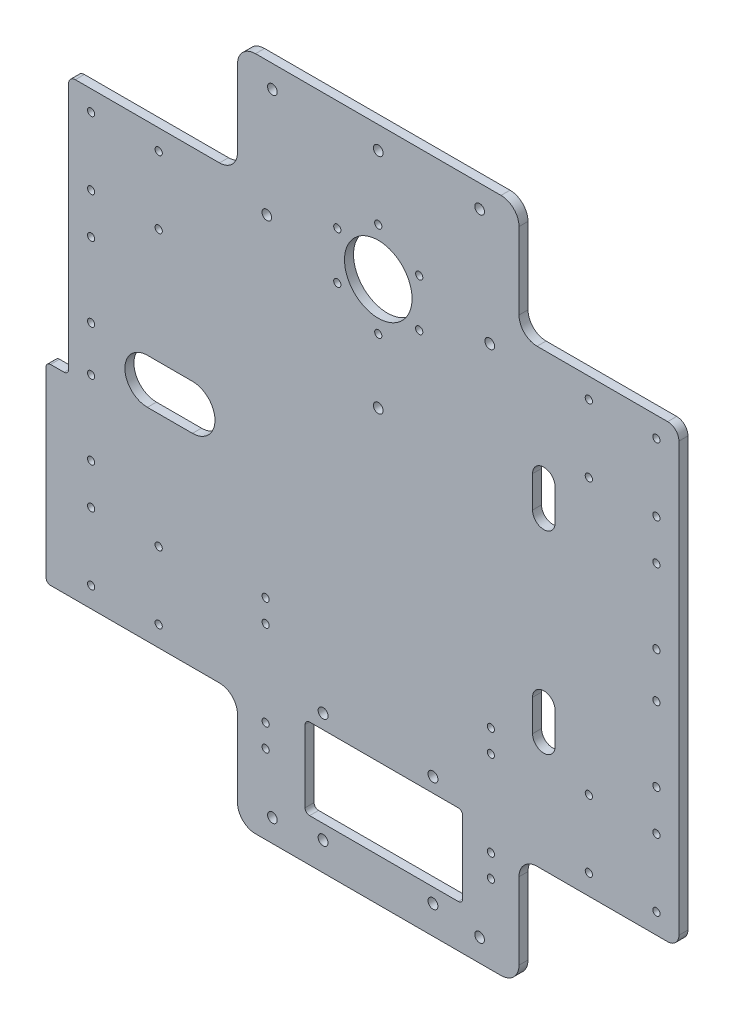
from build123d import *

# Parameters (mm, degrees)
SKETCH_281X300_25_R   = 1.6
SKETCH_281X300_25_R_2 = 15
SKETCH_281X300_25_R_3 = 2.15
SKETCH_281X300_25_R_4 = 2.2
F_4MM_DEPTH           = 4


with BuildPart() as part:
    # 底板轮廓_281x300_安装孔外移25 → 凸台拉伸_4mm (new body)
    with BuildSketch(Plane.XY):
        with BuildLine():
            Line((-55.5, 108), (-55.5, 142))
            ThreePointArc((-55.5, 142), (-53.156854249, 147.656854249), (-47.5, 150))
            Line((-47.5, 150), (61.5, 150))
            ThreePointArc((61.5, 150), (67.156854249, 147.656854249), (69.5, 142))
            Line((69.5, 142), (69.5, 108))
            ThreePointArc((69.5, 108), (71.843145751, 102.343145751), (77.5, 100))
            Line((77.5, 100), (135.5, 100))
            ThreePointArc((135.5, 100), (139.035533906, 98.535533906), (140.5, 95))
            Line((140.5, 95), (140.5, -95))
            ThreePointArc((140.5, -95), (139.035533906, -98.535533906), (135.5, -100))
            Line((135.5, -100), (77.5, -100))
            ThreePointArc((77.5, -100), (71.843145751, -102.343145751), (69.5, -108))
            Line((69.5, -108), (69.5, -142))
            ThreePointArc((69.5, -142), (67.156854249, -147.656854249), (61.5, -150))
            Line((61.5, -150), (-47.5, -150))
            ThreePointArc((-47.5, -150), (-53.156854249, -147.656854249), (-55.5, -142))
            Line((-55.5, -142), (-55.5, -108))
            ThreePointArc((-55.5, -108), (-57.843145751, -102.343145751), (-63.5, -100))
            Line((-63.5, -100), (-138.5, -100))
            ThreePointArc((-138.5, -100), (-139.914213562, -99.414213562), (-140.5, -98))
            Line((-140.5, -98), (-140.5, -17))
            ThreePointArc((-140.5, -17), (-139.914213562, -15.585786438), (-138.5, -15))
            Line((-138.5, -15), (-132.5, -15))
            ThreePointArc((-132.5, -15), (-131.085786438, -14.414213562), (-130.5, -13))
            Line((-130.5, -13), (-130.5, 97))
            ThreePointArc((-130.5, 97), (-129.621320344, 99.121320344), (-127.5, 100))
            Line((-127.5, 100), (-63.5, 100))
            ThreePointArc((-63.5, 100), (-57.843145751, 102.343145751), (-55.5, 108))
        make_face()
        with Locations((100.5, -61)):
            Circle(SKETCH_281X300_25_R, mode=Mode.SUBTRACT)
        with Locations((130.5, -61)):
            Circle(SKETCH_281X300_25_R, mode=Mode.SUBTRACT)
        with Locations((100.5, 61)):
            Circle(SKETCH_281X300_25_R, mode=Mode.SUBTRACT)
        with Locations((7, 90.5)):
            Circle(SKETCH_281X300_25_R_2, mode=Mode.SUBTRACT)
        with Locations((7, 140)):
            Circle(SKETCH_281X300_25_R_3, mode=Mode.SUBTRACT)
        with Locations((-42.5, 90.5)):
            Circle(SKETCH_281X300_25_R_3, mode=Mode.SUBTRACT)
        with Locations((56.5, 90.5)):
            Circle(SKETCH_281X300_25_R_3, mode=Mode.SUBTRACT)
        with Locations((-40, 140)):
            Circle(SKETCH_281X300_25_R_3, mode=Mode.SUBTRACT)
        with Locations((130.5, 61)):
            Circle(SKETCH_281X300_25_R, mode=Mode.SUBTRACT)
        with Locations((7, 41)):
            Circle(SKETCH_281X300_25_R_3, mode=Mode.SUBTRACT)
        with Locations((31.290367902, -137.395183951)):
            Circle(SKETCH_281X300_25_R_4, mode=Mode.SUBTRACT)
        with Locations((-17.5, -137.395183951)):
            Circle(SKETCH_281X300_25_R_4, mode=Mode.SUBTRACT)
        with Locations((-17.5, -88.604816049)):
            Circle(SKETCH_281X300_25_R_4, mode=Mode.SUBTRACT)
        with Locations((31.290367902, -88.604816049)):
            Circle(SKETCH_281X300_25_R_4, mode=Mode.SUBTRACT)
        with Locations((7, 111.5)):
            Circle(SKETCH_281X300_25_R, mode=Mode.SUBTRACT)
        with Locations((25.186533479, 101)):
            Circle(SKETCH_281X300_25_R, mode=Mode.SUBTRACT)
        with Locations((100.5, -91)):
            Circle(SKETCH_281X300_25_R, mode=Mode.SUBTRACT)
        with Locations((25.186533479, 80)):
            Circle(SKETCH_281X300_25_R, mode=Mode.SUBTRACT)
        with Locations((100.5, 91)):
            Circle(SKETCH_281X300_25_R, mode=Mode.SUBTRACT)
        with Locations((7, 69.5)):
            Circle(SKETCH_281X300_25_R, mode=Mode.SUBTRACT)
        with Locations((130.5, 91)):
            Circle(SKETCH_281X300_25_R, mode=Mode.SUBTRACT)
        with Locations((130.5, -91)):
            Circle(SKETCH_281X300_25_R, mode=Mode.SUBTRACT)
        with Locations((-43, -105)):
            Circle(SKETCH_281X300_25_R, mode=Mode.SUBTRACT)
        with Locations((57, -57)):
            Circle(SKETCH_281X300_25_R, mode=Mode.SUBTRACT)
        with Locations((-43, -57)):
            Circle(SKETCH_281X300_25_R, mode=Mode.SUBTRACT)
        with Locations((57, -105)):
            Circle(SKETCH_281X300_25_R, mode=Mode.SUBTRACT)
        with Locations((-11.186533479, 80)):
            Circle(SKETCH_281X300_25_R, mode=Mode.SUBTRACT)
        with Locations((-11.186533479, 101)):
            Circle(SKETCH_281X300_25_R, mode=Mode.SUBTRACT)
        with Locations((130.5, 10)):
            Circle(SKETCH_281X300_25_R, mode=Mode.SUBTRACT)
        with Locations((130.5, -10)):
            Circle(SKETCH_281X300_25_R, mode=Mode.SUBTRACT)
        with Locations((-120.5, 10)):
            Circle(SKETCH_281X300_25_R, mode=Mode.SUBTRACT)
        with Locations((-120.5, -10)):
            Circle(SKETCH_281X300_25_R, mode=Mode.SUBTRACT)
        with Locations((-43, -115)):
            Circle(SKETCH_281X300_25_R, mode=Mode.SUBTRACT)
        with Locations((57, -67)):
            Circle(SKETCH_281X300_25_R, mode=Mode.SUBTRACT)
        with Locations((57, -115)):
            Circle(SKETCH_281X300_25_R, mode=Mode.SUBTRACT)
        with Locations((-43, -67)):
            Circle(SKETCH_281X300_25_R, mode=Mode.SUBTRACT)
        with Locations((-120.5, -91)):
            Circle(SKETCH_281X300_25_R, mode=Mode.SUBTRACT)
        with Locations((-90.5, -91)):
            Circle(SKETCH_281X300_25_R, mode=Mode.SUBTRACT)
        with Locations((-120.5, 91)):
            Circle(SKETCH_281X300_25_R, mode=Mode.SUBTRACT)
        with Locations((-90.5, 91)):
            Circle(SKETCH_281X300_25_R, mode=Mode.SUBTRACT)
        with Locations((-90.5, 61)):
            Circle(SKETCH_281X300_25_R, mode=Mode.SUBTRACT)
        with Locations((-120.5, 61)):
            Circle(SKETCH_281X300_25_R, mode=Mode.SUBTRACT)
        with Locations((-90.5, -61)):
            Circle(SKETCH_281X300_25_R, mode=Mode.SUBTRACT)
        with Locations((-120.5, -61)):
            Circle(SKETCH_281X300_25_R, mode=Mode.SUBTRACT)
        with Locations((130.5, 43)):
            Circle(SKETCH_281X300_25_R, mode=Mode.SUBTRACT)
        with Locations((130.5, -43)):
            Circle(SKETCH_281X300_25_R, mode=Mode.SUBTRACT)
        with Locations((-120.5, 43)):
            Circle(SKETCH_281X300_25_R, mode=Mode.SUBTRACT)
        with Locations((-120.5, -43)):
            Circle(SKETCH_281X300_25_R, mode=Mode.SUBTRACT)
        with Locations((52, 140)):
            Circle(SKETCH_281X300_25_R_3, mode=Mode.SUBTRACT)
        with Locations((-40, -140)):
            Circle(SKETCH_281X300_25_R_3, mode=Mode.SUBTRACT)
        with Locations((52, -140)):
            Circle(SKETCH_281X300_25_R_3, mode=Mode.SUBTRACT)
        with BuildLine():
            Line((-25.5, -97), (-25.5, -129))
            ThreePointArc((-25.5, -129), (-24.914213562, -130.414213562), (-23.5, -131))
            Line((-23.5, -131), (42.5, -131))
            ThreePointArc((42.5, -131), (43.914213562, -130.414213562), (44.5, -129))
            Line((44.5, -129), (44.5, -97))
            ThreePointArc((44.5, -97), (43.914213562, -95.585786438), (42.5, -95))
            Line((42.5, -95), (-23.5, -95))
            ThreePointArc((-23.5, -95), (-24.914213562, -95.585786438), (-25.5, -97))
        make_face(mode=Mode.SUBTRACT)
        with BuildLine():
            Line((75.5, 50), (75.5, 36))
            ThreePointArc((75.5, 36), (80.5, 31), (85.5, 36))
            Line((85.5, 36), (85.5, 50))
            ThreePointArc((85.5, 50), (80.5, 55), (75.5, 50))
        make_face(mode=Mode.SUBTRACT)
        with BuildLine():
            Line((85.5, -50), (85.5, -36))
            ThreePointArc((85.5, -36), (80.5, -31), (75.5, -36))
            Line((75.5, -36), (75.5, -50))
            ThreePointArc((75.5, -50), (80.5, -55), (85.5, -50))
        make_face(mode=Mode.SUBTRACT)
        with BuildLine():
            Line((-95.5, -10), (-75.5, -10))
            ThreePointArc((-75.5, -10), (-65.5, 0), (-75.5, 10))
            Line((-75.5, 10), (-95.5, 10))
            ThreePointArc((-95.5, 10), (-105.5, 0), (-95.5, -10))
        make_face(mode=Mode.SUBTRACT)
    extrude(amount=F_4MM_DEPTH)


solid = part.part
